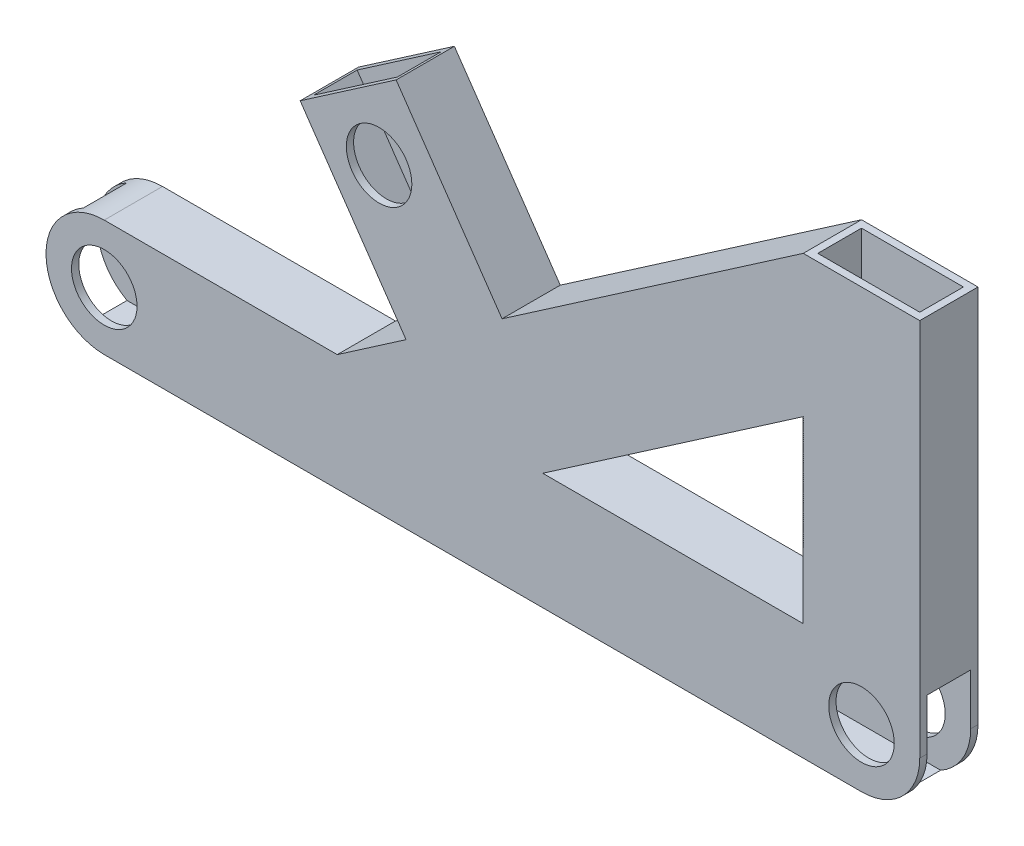
from build123d import *

# Parameters (mm, degrees)
SKETCH1_R           = 14.2875
SKETCH1_R_2         = 25.4
BOSS_EXTRUDE3_DEPTH = 25.4
SKETCH9_R           = 14.2875
CUT_EXTRUDE7_DEPTH  = 1537.409158581
SKETCH10_W          = 19.05
SKETCH10_H          = 44.45
CUT_EXTRUDE8_DEPTH  = 871.429558372
SKETCH11_W          = 44.45
SKETCH11_H          = 19.05
CUT_EXTRUDE9_DEPTH  = 139.835175171
SKETCH13_R          = 14.2875
BOSS_EXTRUDE4_DEPTH = 25.4
SKETCH14_W          = 44.45
SKETCH14_H          = 19.05
CUT_EXTRUDE10_DEPTH = 81.475845846
FILLET3_R           = 25.4


with BuildPart() as part:
    # Sketch1 → Boss-Extrude3 (new body)
    # profile 1 of 13: a face of its own
    with BuildSketch(Plane.XY):
        with BuildLine():
            ThreePointArc((-1322.144654144, 616.967775532), (-1314.705166386, 634.928287774), (-1296.744654144, 642.367775532))
            Line((-1296.744654144, 642.367775532), (-1322.144654144, 642.367775532))
            Line((-1322.144654144, 642.367775532), (-1322.144654144, 616.967775532))
        make_face()
    # profile 2 of 13: a face of its own
    with BuildSketch(Plane.XY):
        with BuildLine():
            ThreePointArc((-1296.744654144, 591.567775532), (-1314.705166386, 599.00726329), (-1322.144654144, 616.967775532))
            Line((-1322.144654144, 616.967775532), (-1322.144654144, 591.567775532))
            Line((-1322.144654144, 591.567775532), (-1296.744654144, 591.567775532))
        make_face()
    # profile 3 of 13: a face of its own
    with BuildSketch(Plane.XY):
        with BuildLine():
            ThreePointArc((-1258.644654144, 616.967775532), (-1261.152687268, 630.562697152), (-1268.34659083, 642.367775532))
            Line((-1268.34659083, 642.367775532), (-1296.744654144, 642.367775532))
            ThreePointArc((-1296.744654144, 642.367775532), (-1278.784141902, 634.928287774), (-1271.344654144, 616.967775532))
            ThreePointArc((-1271.344654144, 616.967775532), (-1278.784141902, 599.00726329), (-1296.744654144, 591.567775532))
            Line((-1296.744654144, 591.567775532), (-1268.34659083, 591.567775532))
            ThreePointArc((-1268.34659083, 591.567775532), (-1261.152687268, 603.372853911), (-1258.644654144, 616.967775532))
        make_face()
    # profile 4 of 13: a face of its own
    with BuildSketch(Plane.XY):
        with BuildLine():
            Line((-1166.346089039, 600.519446439), (-1195.144654144, 642.367775532))
            Line((-1195.144654144, 642.367775532), (-1268.34659083, 642.367775532))
            ThreePointArc((-1268.34659083, 642.367775532), (-1261.152687268, 630.562697152), (-1258.644654144, 616.967775532))
            ThreePointArc((-1258.644654144, 616.967775532), (-1261.152687268, 603.372853911), (-1268.34659083, 591.567775532))
            Line((-1268.34659083, 591.567775532), (-1128.284013271, 591.567775532))
            Line((-1128.284013271, 591.567775532), (-1128.284013271, 626.712443646))
            Line((-1128.284013271, 626.712443646), (-1166.346089039, 600.519446439))
        make_face()
    # profile 5 of 13: a face of its own
    with BuildSketch(Plane.XY):
        Polygon((-1128.284013271, 642.367775532), (-1195.144654144, 642.367775532), (-1166.346089039, 600.519446439), (-1128.284013271, 626.712443646), align=None)
    # profile 6 of 13: a face of its own
    with BuildSketch(Plane.XY):
        Polygon((-991.944654144, 720.536450369), (-991.944654144, 782.202950703), (-1195.144654144, 642.367775532), (-1128.284013271, 642.367775532), (-1105.534633972, 642.367775532), align=None)
    # profile 7 of 13: a face of its own
    with BuildSketch(Plane.XY):
        Polygon((-1105.534633972, 642.367775532), (-1128.284013271, 642.367775532), (-1128.284013271, 626.712443646), align=None)
    # profile 8 of 13: a face of its own
    with BuildSketch(Plane.XY):
        Polygon((-941.144654144, 591.567775532), (-941.144654144, 642.367775532), (-991.944654144, 642.367775532), (-1105.534633972, 642.367775532), (-1128.284013271, 626.712443646), (-1128.284013271, 591.567775532), align=None)
        with Locations((-966.544654144, 616.967775532)):
            Circle(SKETCH1_R, mode=Mode.SUBTRACT)
    # profile 9 of 13: a face of its own
    with BuildSketch(Plane.XY):
        Polygon((-941.144654144, 782.202950703), (-991.944654144, 782.202950703), (-963.146089039, 740.354621609), (-991.944654144, 720.536450369), (-991.944654144, 642.367775532), (-941.144654144, 642.367775532), align=None)
    # profile 10 of 13: a face of its own
    with BuildSketch(Plane.XY):
        Polygon((-963.146089039, 740.354621609), (-991.944654144, 782.202950703), (-991.944654144, 720.536450369), align=None)
    # profile 11 of 13: a face of its own
    with BuildSketch(Plane.XY):
        with Locations((-966.544654144, 616.967775532)):
            Circle(SKETCH1_R)
    # profile 12 of 13: a face of its own
    with BuildSketch(Plane.XY):
        with Locations((-1296.744654144, 616.967775532)):
            Circle(SKETCH1_R_2)
        with Locations((-1296.744654144, 616.967775532)):
            Circle(SKETCH1_R, mode=Mode.SUBTRACT)
    # profile 13 of 13: a face of its own
    with BuildSketch(Plane.XY):
        with Locations((-1296.744654144, 616.967775532)):
            Circle(SKETCH1_R)
    extrude(amount=BOSS_EXTRUDE3_DEPTH)

    # Sketch9 → Cut-Extrude7 (cut, through all)
    with BuildSketch(Plane.XY.offset(25.4)):
        with Locations((-1296.744654144, 616.967775532)):
            Circle(SKETCH9_R)
        with Locations((-966.544654144, 616.967775532)):
            Circle(SKETCH9_R)
    extrude(amount=-CUT_EXTRUDE7_DEPTH, mode=Mode.SUBTRACT)

    # Sketch10 → Cut-Extrude8 (cut, through all)
    with BuildSketch(Plane.ZY.offset(1322.144654144)):
        with Locations((12.7, 616.967775532)):
            Rectangle(SKETCH10_W, SKETCH10_H)
    extrude(amount=-CUT_EXTRUDE8_DEPTH, mode=Mode.SUBTRACT)

    # Sketch11 → Cut-Extrude9 (cut)
    with BuildSketch(Plane(origin=(0, 782.202950703, 0), x_dir=(1, 0, 0), z_dir=(0, 1, 0))):
        with Locations((-966.544654144, -12.7)):
            Rectangle(SKETCH11_W, SKETCH11_H)
    extrude(amount=-CUT_EXTRUDE9_DEPTH, mode=Mode.SUBTRACT)

    # Sketch13 → Boss-Extrude4 (add)
    # profile 1 of 2: a face of its own
    with BuildSketch(Plane.XY):
        with BuildLine():
            Line((-1169.471208218, 758.939487681), (-1211.319537311, 730.140922576))
            Line((-1211.319537311, 730.140922576), (-1180.283016907, 685.040532503))
            ThreePointArc((-1180.283016907, 685.040532503), (-1154.1022052, 692.46774594), (-1139.555223473, 715.467392104))
            Line((-1139.555223473, 715.467392104), (-1169.471208218, 758.939487681))
        make_face()
        with Locations((-1176.905095286, 722.990494894)):
            Circle(SKETCH13_R, mode=Mode.SUBTRACT)
    # profile 2 of 2: a face of its own
    with BuildSketch(Plane.XY):
        with BuildLine():
            ThreePointArc((-1139.555223473, 715.467392104), (-1154.1022052, 692.46774594), (-1180.283016907, 685.040532503))
            Line((-1180.283016907, 685.040532503), (-1165.130807959, 663.022260959))
            Line((-1165.130807959, 663.022260959), (-1123.282478866, 691.820826065))
            Line((-1123.282478866, 691.820826065), (-1139.555223473, 715.467392104))
        make_face()
    extrude(amount=BOSS_EXTRUDE4_DEPTH)

    # Sketch14 → Cut-Extrude10 (cut)
    with BuildSketch(Plane(origin=(-730.269249407, 1061.183005622, 0), x_dir=(0.8237860057708082, 0.5669008878950341, 0), z_dir=(-0.5669008878950341, 0.8237860057708082, 0))):
        with Locations((-558.550546057, -12.7)):
            Rectangle(SKETCH14_W, SKETCH14_H)
    extrude(amount=-CUT_EXTRUDE10_DEPTH, mode=Mode.SUBTRACT)

    # Fillet3
    # the kernel refuses this fillet: 25.4 mm, written as the material it takes off along each edge
    with BuildSketch(Plane(origin=(-941.144654144, 591.567775532, -63.5), x_dir=(-1, 0, 0), z_dir=(0, 0, 1)), Plane(origin=(-1322.144654144, 591.567775532, -63.5), x_dir=(0, 1, 0), z_dir=(0, 0, 1)), Plane(origin=(-1322.144654144, 642.367775532, -63.5), x_dir=(1, 0, 0), z_dir=(0, 0, 1))) as fillet3_piece_1:
        with BuildLine():
            CenterArc((FILLET3_R, -FILLET3_R), FILLET3_R, 90, 90)
            Line((0, -FILLET3_R), (0, 0))
            Line((0, 0), (FILLET3_R, 0))
        make_face()
    extrude(amount=152.4, mode=Mode.SUBTRACT)


solid = part.part
